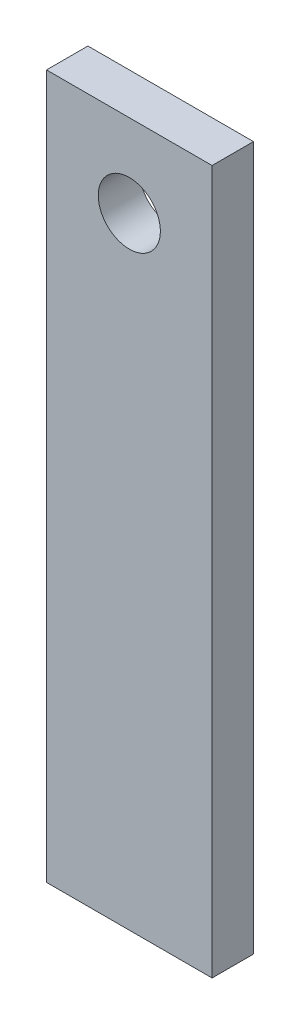
from build123d import *

# Parameters (mm, degrees)
SKETCH1_W           = 76.2
SKETCH1_H           = 323.85
SKETCH1_R           = 14.2875
BOSS_EXTRUDE1_DEPTH = 9.525


with BuildPart() as part:
    # Sketch1 → Boss-Extrude1 (new, symmetric)
    with BuildSketch(Plane.XY):
        with Locations((0, -123.825)):
            Rectangle(SKETCH1_W, SKETCH1_H)
        Circle(SKETCH1_R, mode=Mode.SUBTRACT)
    extrude(amount=BOSS_EXTRUDE1_DEPTH, both=True)


solid = part.part
